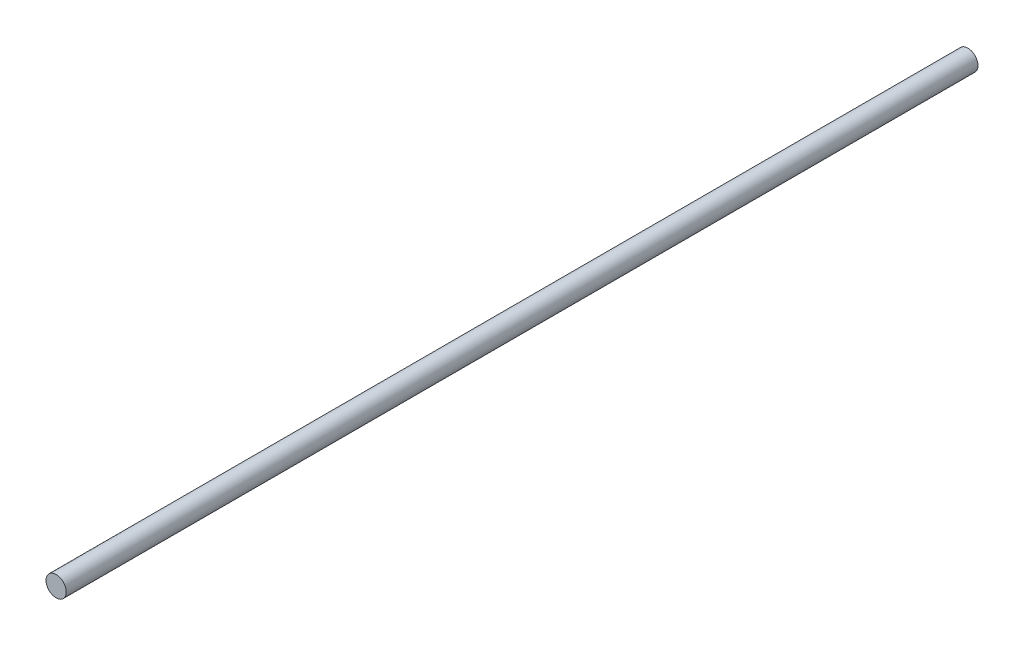
from build123d import *

# Parameters (mm, degrees)
SKETCH1_R           = 1
BOSS_EXTRUDE1_DEPTH = 90


with BuildPart() as part:
    # Sketch1 → Boss-Extrude1 (new body)
    with BuildSketch(Plane.XY):
        with Locations((20, 0)):
            Circle(SKETCH1_R)
    extrude(amount=-BOSS_EXTRUDE1_DEPTH)


solid = part.part
